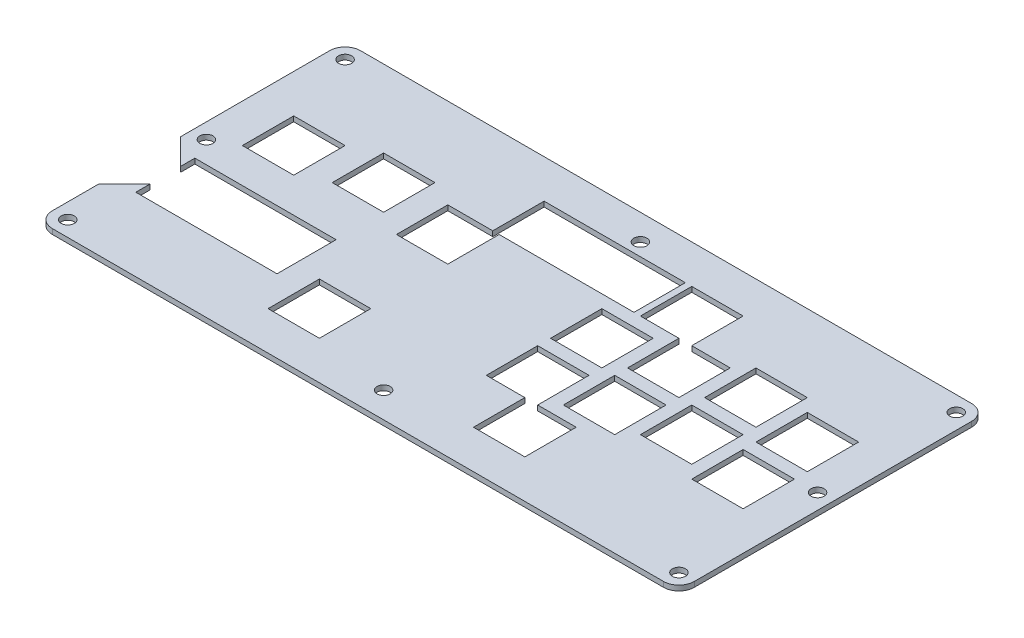
from build123d import *

# Parameters (mm, degrees)
SKETCH_1_R      = 2.55
SKETCH_1_W      = 20
SKETCH_1_H      = 20
EXTRUDE_1_DEPTH = 2


with BuildPart() as part:
    # 草图1 → 凸台-拉伸1 (new body)
    with BuildSketch(Plane(origin=(0, 0, 0), x_dir=(1, 0, 0), z_dir=(0, 1, 0))):
        with BuildLine():
            Line((11.127489431, 120.033204521), (11.127489431, 62.033204521))
            Line((11.127489431, 62.033204521), (21.127489431, 52.033204521))
            Line((21.127489431, 52.033204521), (21.127489431, 57.533204521))
            Line((21.127489431, 57.533204521), (76.127489431, 57.533204521))
            Line((76.127489431, 57.533204521), (76.127489431, 34.533204521))
            Line((76.127489431, 34.533204521), (21.127489431, 34.533204521))
            Line((21.127489431, 34.533204521), (21.127489431, 40.033204521))
            Line((21.127489431, 40.033204521), (11.127489431, 30.033204521))
            Line((11.127489431, 30.033204521), (11.127489431, 12.033204521))
            ThreePointArc((11.127489431, 12.033204521), (12.884848744, 7.790563834), (17.127489431, 6.033204521))
            Line((17.127489431, 6.033204521), (255.127489431, 6.033204521))
            ThreePointArc((255.127489431, 6.033204521), (259.370130118, 7.790563834), (261.127489431, 12.033204521))
            Line((261.127489431, 12.033204521), (261.127489431, 120.033204521))
            ThreePointArc((261.127489431, 120.033204521), (259.370130118, 124.275845208), (255.127489431, 126.033204521))
            Line((255.127489431, 126.033204521), (17.127489431, 126.033204521))
            ThreePointArc((17.127489431, 126.033204521), (12.884848744, 124.275845208), (11.127489431, 120.033204521))
        make_face()
        with Locations((17.127489431, 12.033204521)):
            Circle(SKETCH_1_R, mode=Mode.SUBTRACT)
        with Locations((96.127489431, 31.033204521)):
            Rectangle(SKETCH_1_W, SKETCH_1_H, mode=Mode.SUBTRACT)
        with Locations((17.127489431, 66.033204521)):
            Circle(SKETCH_1_R, mode=Mode.SUBTRACT)
        with Locations((136.127489431, 16.033204521)):
            Circle(SKETCH_1_R, mode=Mode.SUBTRACT)
        with Locations((255.127489431, 12.033204521)):
            Circle(SKETCH_1_R, mode=Mode.SUBTRACT)
        Polygon((166.127489431, 21.033204521), (166.127489431, 41.033204521), (151.127489431, 41.033204521), (151.127489431, 61.033204521), (171.127489431, 61.033204521), (171.127489431, 41.033204521), (186.127489431, 41.033204521), (186.127489431, 21.033204521), align=None, mode=Mode.SUBTRACT)
        with Locations((186.127489431, 56.033204521)):
            Rectangle(SKETCH_1_W, SKETCH_1_H, mode=Mode.SUBTRACT)
        with Locations((211.127489431, 61.033204521)):
            Rectangle(SKETCH_1_W, SKETCH_1_H, mode=Mode.SUBTRACT)
        with Locations((236.127489431, 56.033204521)):
            Rectangle(SKETCH_1_W, SKETCH_1_H, mode=Mode.SUBTRACT)
        with Locations((255.127489431, 66.033204521)):
            Circle(SKETCH_1_R, mode=Mode.SUBTRACT)
        with Locations((36.127489431, 81.033204521)):
            Rectangle(SKETCH_1_W, SKETCH_1_H, mode=Mode.SUBTRACT)
        with Locations((66.127489431, 86.033204521)):
            Rectangle(SKETCH_1_W, SKETCH_1_H, mode=Mode.SUBTRACT)
        Polygon((158.627489431, 91.033204521), (106.127489431, 91.033204521), (106.127489431, 71.033204521), (86.127489431, 71.033204521), (86.127489431, 91.033204521), (103.627489431, 91.033204521), (103.627489431, 104.033204521), (103.627489431, 111.033204521), (158.627489431, 111.033204521), align=None, mode=Mode.SUBTRACT)
        with Locations((17.127489431, 120.033204521)):
            Circle(SKETCH_1_R, mode=Mode.SUBTRACT)
        with Locations((161.127489431, 76.033204521)):
            Rectangle(SKETCH_1_W, SKETCH_1_H, mode=Mode.SUBTRACT)
        Polygon((176.127489431, 71.033204521), (176.127489431, 91.033204521), (161.127489431, 91.033204521), (161.127489431, 111.033204521), (181.127489431, 111.033204521), (181.127489431, 91.033204521), (196.127489431, 91.033204521), (196.127489431, 71.033204521), align=None, mode=Mode.SUBTRACT)
        with Locations((211.127489431, 86.033204521)):
            Rectangle(SKETCH_1_W, SKETCH_1_H, mode=Mode.SUBTRACT)
        with Locations((236.127489431, 81.033204521)):
            Rectangle(SKETCH_1_W, SKETCH_1_H, mode=Mode.SUBTRACT)
        with Locations((136.127489431, 116.033204521)):
            Circle(SKETCH_1_R, mode=Mode.SUBTRACT)
        with Locations((255.127489431, 120.033204521)):
            Circle(SKETCH_1_R, mode=Mode.SUBTRACT)
    extrude(amount=EXTRUDE_1_DEPTH)


solid = part.part
